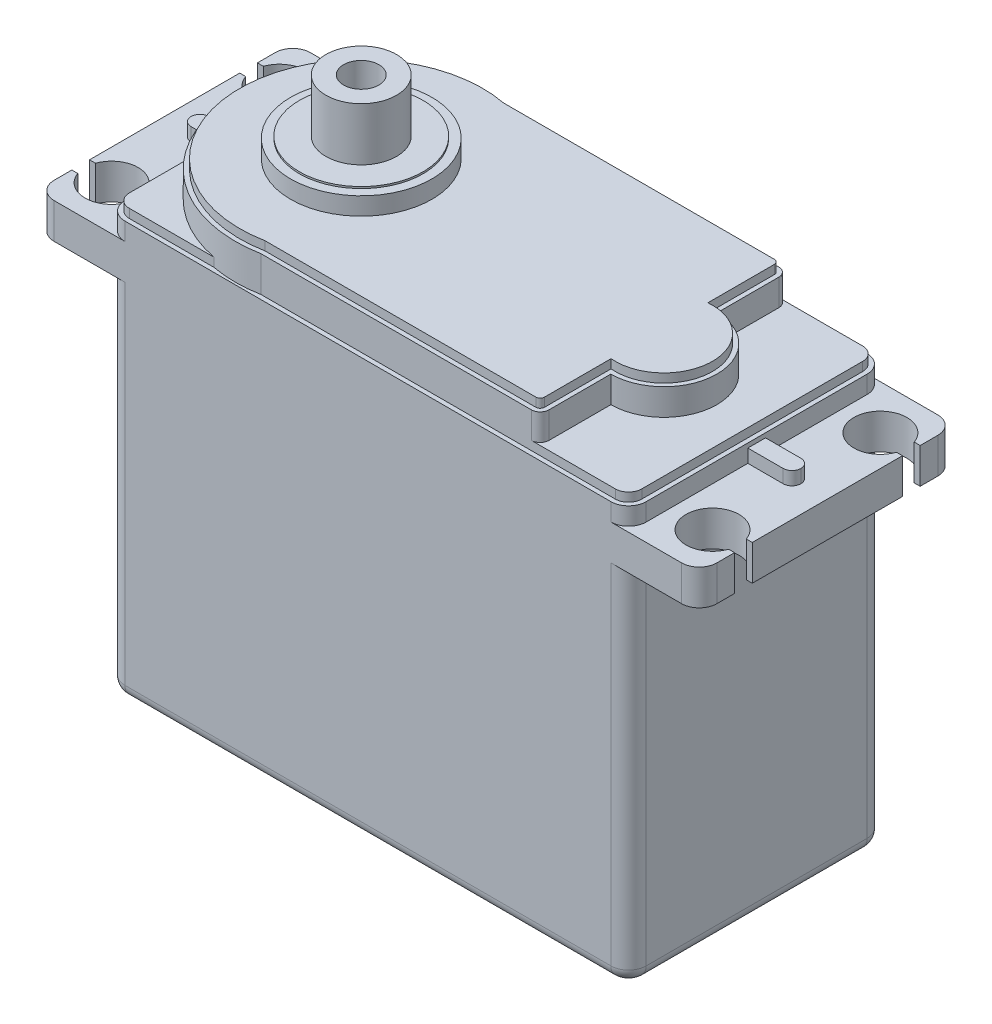
from build123d import *

# Parameters (mm, degrees)
SKETCH2_W            = 59
SKETCH2_H            = 29
BOSS_EXTRUDE1_DEPTH  = 47
FILLET1_R            = 1.5
SKETCH3_W            = 29
SKETCH3_H            = 4
BOSS_EXTRUDE2_DEPTH  = 8
CUT_EXTRUDE1_DEPTH   = 47
FILLET2_R            = 2
SKETCH6_W            = 5
SKETCH6_H            = 2
BOSS_EXTRUDE3_DEPTH  = 1.5
FILLET3_R            = 1
FILLET3_OF_MIRROR2_R = 1
FILLET4_R            = 2
BOSS_EXTRUDE4_DEPTH  = 1
BOSS_EXTRUDE6_DEPTH  = 3
BOSS_EXTRUDE8_REACH  = 64.614
BOSS_EXTRUDE9_REACH  = 64.614
BOSS_EXTRUDE10_REACH = 64.614
FILLET5_R            = 1
BOSS_EXTRUDE11_DEPTH = 1
SKETCH15_R           = 8
BOSS_EXTRUDE12_DEPTH = 2
SKETCH16_R           = 7
BOSS_EXTRUDE13_DEPTH = 0.2
SKETCH17_R           = 4
BOSS_EXTRUDE14_DEPTH = 6
SKETCH18_R           = 2
CUT_EXTRUDE2_DEPTH   = 4


# Some blends are built 0.0001 mm under size
with BuildPart() as part:
    # Sketch2 → Boss-Extrude1 (new body)
    with BuildSketch(Plane(origin=(0, 0, 0), x_dir=(1, 0, 0), z_dir=(0, 1, 0))):
        Rectangle(SKETCH2_W, SKETCH2_H)
    extrude(amount=BOSS_EXTRUDE1_DEPTH)

    # Fillet1
    fillet1_edges = [part.edges().sort_by_distance(p)[0] for p in [
        (0, 0, 14.5),
        (-29.5, 0, 0),
        (0, 0, -14.5),
        (29.5, 0, 0),
    ]]
    fillet(fillet1_edges, radius=FILLET1_R)

    # Sketch3 → Boss-Extrude2 (add)
    with BuildSketch(Plane(origin=(29.5, 0, 0), x_dir=(0, 0, -1), z_dir=(1, 0, 0))):
        with Locations((0, 43)):
            Rectangle(SKETCH3_W, SKETCH3_H)
    boss_extrude2 = extrude(amount=BOSS_EXTRUDE2_DEPTH)

    # Sketch4 → Cut-Extrude1 (cut)
    with BuildSketch(Plane(origin=(0, 45, 0), x_dir=(1, 0, 0), z_dir=(0, 1, 0))):
        with BuildLine():
            Line((36.828427125, -8.5), (37.5, -8.5))
            Line((37.5, -8.5), (37.5, -10.5))
            Line((37.5, -10.5), (36.828427125, -10.5))
            ThreePointArc((36.828427125, -10.5), (31, -9.5), (36.828427125, -8.5))
        make_face()
        with BuildLine():
            Line((37.5, 8.5), (37.5, 10.5))
            Line((37.5, 10.5), (36.828427125, 10.5))
            ThreePointArc((36.828427125, 10.5), (31, 9.5), (36.828427125, 8.5))
            Line((36.828427125, 8.5), (37.5, 8.5))
        make_face()
    cut_extrude1 = extrude(amount=-CUT_EXTRUDE1_DEPTH, mode=Mode.SUBTRACT)

    # Mirror1: Boss-Extrude2, Cut-Extrude1 across plane
    add(boss_extrude2.mirror(Plane(origin=(0, 0, 0), x_dir=(0, 0, 1), z_dir=(1, 0, 0))))
    add(cut_extrude1.mirror(Plane(origin=(0, 0, 0), x_dir=(0, 0, 1), z_dir=(1, 0, 0))), mode=Mode.SUBTRACT)

    # Fillet2
    fillet2_edges = [part.edges().sort_by_distance(p)[0] for p in [
        (37.5, 43, 14.5),
        (37.5, 43, -14.5),
        (-37.5, 43, 14.5),
        (-37.5, 43, -14.5),
    ]]
    fillet(fillet2_edges, radius=FILLET2_R)

    # Sketch6 → Boss-Extrude3 (add)
    with BuildSketch(Plane(origin=(0, 45, 0), x_dir=(1, 0, 0), z_dir=(0, 1, 0))):
        with Locations((32, 0)):
            Rectangle(SKETCH6_W, SKETCH6_H)
    boss_extrude3 = extrude(amount=BOSS_EXTRUDE3_DEPTH)

    # Fillet3
    fillet3_edges = [part.edges().sort_by_distance(p)[0] for p in [
        (34.5, 45.75, -1),
        (34.5, 45.75, 1),
    ]]
    fillet(fillet3_edges, radius=FILLET3_R - 0.0001)  # a hair under: the kernel refuses the full size

    # Mirror2: Boss-Extrude3 across plane
    add(boss_extrude3.mirror(Plane(origin=(0, 0, 0), x_dir=(0, 0, 1), z_dir=(1, 0, 0))))

    # Fillet3 of Mirror2
    fillet3_of_mirror2_edges = [part.edges().sort_by_distance(p)[0] for p in [
        (-34.5, 45.75, -1),
        (-34.5, 45.75, 1),
    ]]
    fillet(fillet3_of_mirror2_edges, radius=FILLET3_OF_MIRROR2_R - 0.0001)  # a hair under: the kernel refuses the full size

    # Fillet4
    # the kernel refuses this fillet: 2 mm, written as the material it takes off along each edge
    with BuildSketch(Plane(origin=(27.5, 0, 12.5), x_dir=(1, 0, 0), z_dir=(0, 0, -1))) as fillet4_piece_1:
        with BuildLine():
            CenterArc((0.5, -1.5), 1.5, 0, 90)
            Line((2, -1.5), (2, 0))
            Line((2, 0), (0.5, 0))
        make_face()
    revolve(axis=Axis((27.5, 0, 12.5), (0, -1, 0)), revolution_arc=90, mode=Mode.SUBTRACT)
    with BuildSketch(Plane(origin=(-27.5, 0, 12.5), x_dir=(0, 0, 1), z_dir=(1, 0, 0))) as fillet4_piece_2:
        with BuildLine():
            CenterArc((0.5, -1.5), 1.5, 0, 90)
            Line((2, -1.5), (2, 0))
            Line((2, 0), (0.5, 0))
        make_face()
    revolve(axis=Axis((-27.5, 0, 12.5), (0, -1, 0)), revolution_arc=90, mode=Mode.SUBTRACT)
    with BuildSketch(Plane(origin=(27.5, 0, -12.5), x_dir=(0, 0, -1), z_dir=(-1, 0, 0))) as fillet4_piece_3:
        with BuildLine():
            CenterArc((0.5, -1.5), 1.5, 0, 90)
            Line((2, -1.5), (2, 0))
            Line((2, 0), (0.5, 0))
        make_face()
    revolve(axis=Axis((27.5, 0, -12.5), (0, -1, 0)), revolution_arc=90, mode=Mode.SUBTRACT)
    with BuildSketch(Plane(origin=(-27.5, 0, -12.5), x_dir=(-1, 0, 0), z_dir=(0, 0, 1))) as fillet4_piece_4:
        with BuildLine():
            CenterArc((0.5, -1.5), 1.5, 0, 90)
            Line((2, -1.5), (2, 0))
            Line((2, 0), (0.5, 0))
        make_face()
    revolve(axis=Axis((-27.5, 0, -12.5), (0, -1, 0)), revolution_arc=90, mode=Mode.SUBTRACT)
    with BuildSketch(Plane(origin=(29.5, 0, 14.5), x_dir=(-1, 0, 0), z_dir=(0, 1, 0)), Plane(origin=(-29.5, 0, -14.5), x_dir=(1, 0, 0), z_dir=(0, 1, 0))) as fillet4_piece_5:
        with BuildLine():
            CenterArc((FILLET4_R, -FILLET4_R), FILLET4_R, 90, 90)
            Line((0, -FILLET4_R), (0, 0))
            Line((0, 0), (FILLET4_R, 0))
        make_face()
    extrude(amount=41, mode=Mode.SUBTRACT)
    with BuildSketch(Plane(origin=(29.5, 0, 14.5), x_dir=(-1, 0, 0), z_dir=(0, 1, 0))) as fillet4_piece_6_section:
        with BuildLine():
            CenterArc((FILLET4_R, -FILLET4_R), FILLET4_R, 90, 90)
            Line((0, -FILLET4_R), (0, 0))
            Line((0, 0), (FILLET4_R, 0))
        make_face()
    fillet4_piece_6 = extrude(amount=46, mode=Mode.PRIVATE)
    fillet4_piece_6 = split(fillet4_piece_6, bisect_by=Plane(origin=(29.047209771, 45, 14.047209771), z_dir=(0, 1, 0)), keep=Keep.TOP, mode=Mode.PRIVATE)
    add(fillet4_piece_6, mode=Mode.SUBTRACT)
    with BuildSketch(Plane(origin=(29.5, 0, -14.5), x_dir=(-1, 0, 0), z_dir=(0, 1, 0)), Plane(origin=(-29.5, 0, 14.5), x_dir=(1, 0, 0), z_dir=(0, 1, 0))) as fillet4_piece_7:
        with BuildLine():
            CenterArc((FILLET4_R, FILLET4_R), FILLET4_R, 180, 90)
            Line((0, FILLET4_R), (0, 0))
            Line((0, 0), (FILLET4_R, 0))
        make_face()
    extrude(amount=41, mode=Mode.SUBTRACT)
    with BuildSketch(Plane(origin=(29.5, 0, -14.5), x_dir=(-1, 0, 0), z_dir=(0, 1, 0))) as fillet4_piece_8_section:
        with BuildLine():
            CenterArc((FILLET4_R, FILLET4_R), FILLET4_R, 180, 90)
            Line((0, FILLET4_R), (0, 0))
            Line((0, 0), (FILLET4_R, 0))
        make_face()
    fillet4_piece_8 = extrude(amount=46, mode=Mode.PRIVATE)
    fillet4_piece_8 = split(fillet4_piece_8, bisect_by=Plane(origin=(29.047209771, 45, -14.047209771), z_dir=(0, 1, 0)), keep=Keep.TOP, mode=Mode.PRIVATE)
    add(fillet4_piece_8, mode=Mode.SUBTRACT)
    with BuildSketch(Plane(origin=(29.5, 40, 14.5), x_dir=(-1, 0, 0), z_dir=(0, 1, 0))) as fillet4_piece_9_section:
        with BuildLine():
            CenterArc((FILLET4_R, -FILLET4_R), FILLET4_R, 90, 90)
            Line((0, -FILLET4_R), (0, 0))
            Line((0, 0), (FILLET4_R, 0))
        make_face()
    fillet4_piece_9 = extrude(amount=12, mode=Mode.PRIVATE)
    fillet4_piece_9 = split(fillet4_piece_9, bisect_by=Plane(origin=(29.047209771, 41, 14.047209771), z_dir=(0, -1, 0)), keep=Keep.TOP, mode=Mode.PRIVATE)
    add(fillet4_piece_9, mode=Mode.SUBTRACT)
    with BuildSketch(Plane(origin=(29.5, 45, 14.5), x_dir=(-1, 0, 0), z_dir=(0, 1, 0)), Plane(origin=(-29.5, 45, 14.5), x_dir=(0, 0, -1), z_dir=(0, 1, 0))) as fillet4_piece_10:
        with BuildLine():
            CenterArc((FILLET4_R, -FILLET4_R), FILLET4_R, 90, 90)
            Line((0, -FILLET4_R), (0, 0))
            Line((0, 0), (FILLET4_R, 0))
        make_face()
    extrude(amount=7, mode=Mode.SUBTRACT)
    with BuildSketch(Plane(origin=(-29.5, 40, 14.5), x_dir=(0, 0, -1), z_dir=(0, 1, 0))) as fillet4_piece_11_section:
        with BuildLine():
            CenterArc((FILLET4_R, -FILLET4_R), FILLET4_R, 90, 90)
            Line((0, -FILLET4_R), (0, 0))
            Line((0, 0), (FILLET4_R, 0))
        make_face()
    fillet4_piece_11 = extrude(amount=12, mode=Mode.PRIVATE)
    fillet4_piece_11 = split(fillet4_piece_11, bisect_by=Plane(origin=(-29.047209771, 41, 14.047209771), z_dir=(0, -1, 0)), keep=Keep.TOP, mode=Mode.PRIVATE)
    add(fillet4_piece_11, mode=Mode.SUBTRACT)
    with BuildSketch(Plane(origin=(-29.5, 40, -14.5), x_dir=(0, 0, 1), z_dir=(0, 1, 0))) as fillet4_piece_12_section:
        with BuildLine():
            CenterArc((FILLET4_R, FILLET4_R), FILLET4_R, 180, 90)
            Line((0, FILLET4_R), (0, 0))
            Line((0, 0), (FILLET4_R, 0))
        make_face()
    fillet4_piece_12 = extrude(amount=12, mode=Mode.PRIVATE)
    fillet4_piece_12 = split(fillet4_piece_12, bisect_by=Plane(origin=(-29.047209771, 41, -14.047209771), z_dir=(0, -1, 0)), keep=Keep.TOP, mode=Mode.PRIVATE)
    add(fillet4_piece_12, mode=Mode.SUBTRACT)
    with BuildSketch(Plane(origin=(-29.5, 45, -14.5), x_dir=(0, 0, 1), z_dir=(0, 1, 0)), Plane(origin=(29.5, 45, -14.5), x_dir=(-1, 0, 0), z_dir=(0, 1, 0))) as fillet4_piece_13:
        with BuildLine():
            CenterArc((FILLET4_R, FILLET4_R), FILLET4_R, 180, 90)
            Line((0, FILLET4_R), (0, 0))
            Line((0, 0), (FILLET4_R, 0))
        make_face()
    extrude(amount=7, mode=Mode.SUBTRACT)
    with BuildSketch(Plane(origin=(29.5, 40, -14.5), x_dir=(-1, 0, 0), z_dir=(0, 1, 0))) as fillet4_piece_14_section:
        with BuildLine():
            CenterArc((FILLET4_R, FILLET4_R), FILLET4_R, 180, 90)
            Line((0, FILLET4_R), (0, 0))
            Line((0, 0), (FILLET4_R, 0))
        make_face()
    fillet4_piece_14 = extrude(amount=12, mode=Mode.PRIVATE)
    fillet4_piece_14 = split(fillet4_piece_14, bisect_by=Plane(origin=(29.047209771, 41, -14.047209771), z_dir=(0, -1, 0)), keep=Keep.TOP, mode=Mode.PRIVATE)
    add(fillet4_piece_14, mode=Mode.SUBTRACT)
    with BuildSketch(Plane(origin=(-29.5, 0, 14.5), x_dir=(1, 0, 0), z_dir=(0, 1, 0))) as fillet4_piece_15_section:
        with BuildLine():
            CenterArc((FILLET4_R, FILLET4_R), FILLET4_R, 180, 90)
            Line((0, FILLET4_R), (0, 0))
            Line((0, 0), (FILLET4_R, 0))
        make_face()
    fillet4_piece_15 = extrude(amount=46, mode=Mode.PRIVATE)
    fillet4_piece_15 = split(fillet4_piece_15, bisect_by=Plane(origin=(-29.047209771, 45, 14.047209771), z_dir=(0, 1, 0)), keep=Keep.TOP, mode=Mode.PRIVATE)
    add(fillet4_piece_15, mode=Mode.SUBTRACT)
    with BuildSketch(Plane(origin=(-29.5, 0, -14.5), x_dir=(1, 0, 0), z_dir=(0, 1, 0))) as fillet4_piece_16_section:
        with BuildLine():
            CenterArc((FILLET4_R, -FILLET4_R), FILLET4_R, 90, 90)
            Line((0, -FILLET4_R), (0, 0))
            Line((0, 0), (FILLET4_R, 0))
        make_face()
    fillet4_piece_16 = extrude(amount=46, mode=Mode.PRIVATE)
    fillet4_piece_16 = split(fillet4_piece_16, bisect_by=Plane(origin=(-29.047209771, 45, -14.047209771), z_dir=(0, 1, 0)), keep=Keep.TOP, mode=Mode.PRIVATE)
    add(fillet4_piece_16, mode=Mode.SUBTRACT)

    # Sketch7 → Boss-Extrude4 (add)
    with BuildSketch(Plane(origin=(0, 47, 0), x_dir=(1, 0, 0), z_dir=(0, 1, 0))):
        with BuildLine():
            Line((-29, 12.5), (-29, -12.5))
            ThreePointArc((-29, -12.5), (-28.560660172, -13.560660172), (-27.5, -14))
            Line((-27.5, -14), (27.5, -14))
            ThreePointArc((27.5, -14), (28.560660172, -13.560660172), (29, -12.5))
            Line((29, -12.5), (29, 12.5))
            ThreePointArc((29, 12.5), (28.560660172, 13.560660172), (27.5, 14))
            Line((27.5, 14), (-27.5, 14))
            ThreePointArc((-27.5, 14), (-28.560660172, 13.560660172), (-29, 12.5))
        make_face()
    extrude(amount=BOSS_EXTRUDE4_DEPTH)

    # Sketch8 → Boss-Extrude6 (add)
    with BuildSketch(Plane(origin=(0, 48, 0), x_dir=(1, 0, 0), z_dir=(0, 1, 0))):
        with BuildLine():
            Line((19, -14), (-12.592463547, -14))
            ThreePointArc((-12.592463547, -14), (-29.5, 0), (-12.592463547, 14))
            Line((-12.592463547, 14), (19, 14))
            Line((19, 14), (19, 6))
            ThreePointArc((19, 6), (25, 0), (19, -6))
            Line((19, -6), (19, -14))
        make_face()
    extrude(amount=BOSS_EXTRUDE6_DEPTH)

    # Sketch10 → Boss-Extrude8 (add, up to next)
    with BuildSketch(Plane.XZ.offset(-48), mode=Mode.PRIVATE) as boss_extrude8_sk1:
        with BuildLine():
            Line((-17.907536453, 14), (-12.592463547, 14))
            ThreePointArc((-12.592463547, 14), (-15.25, 14.25), (-17.907536453, 14))
        make_face()
    boss_extrude8_tool1 = extrude(boss_extrude8_sk1.sketch, amount=BOSS_EXTRUDE8_REACH, mode=Mode.PRIVATE) - part.part
    add(boss_extrude8_tool1.solids().sort_by_distance((-15.25, 48, 14.100076))[0])

    # Sketch11 → Boss-Extrude9 (add, up to next)
    with BuildSketch(Plane.XZ.offset(-48), mode=Mode.PRIVATE) as boss_extrude9_sk1:
        with BuildLine():
            Line((-29, -3.741657387), (-29, 3.741657387))
            ThreePointArc((-29, 3.741657387), (-29.5, 0), (-29, -3.741657387))
        make_face()
    boss_extrude9_tool1 = extrude(boss_extrude9_sk1.sketch, amount=BOSS_EXTRUDE9_REACH, mode=Mode.PRIVATE) - part.part
    add(boss_extrude9_tool1.solids().sort_by_distance((-29.200304, 48, 0))[0])

    # Sketch12 → Boss-Extrude10 (add, up to next)
    with BuildSketch(Plane.XZ.offset(-48), mode=Mode.PRIVATE) as boss_extrude10_sk1:
        with BuildLine():
            Line((-12.592463547, -14), (-17.907536453, -14))
            ThreePointArc((-17.907536453, -14), (-15.25, -14.25), (-12.592463547, -14))
        make_face()
    boss_extrude10_tool1 = extrude(boss_extrude10_sk1.sketch, amount=BOSS_EXTRUDE10_REACH, mode=Mode.PRIVATE) - part.part
    add(boss_extrude10_tool1.solids().sort_by_distance((-15.25, 48, -14.100076))[0])

    # Fillet5
    fillet5_edges = [part.edges().sort_by_distance(p)[0] for p in [
        (19, 49.5, 14),
        (19, 49.5, -14),
    ]]
    fillet(fillet5_edges, radius=FILLET5_R)

    # Sketch13 → Boss-Extrude11 (add)
    with BuildSketch(Plane(origin=(0, 51, 0), x_dir=(1, 0, 0), z_dir=(0, 1, 0))):
        with BuildLine():
            Line((18.5, 5.477225575), (18.5, 13))
            ThreePointArc((18.5, 13), (18.353553391, 13.353553391), (18, 13.5))
            Line((18, 13.5), (-12.639923373, 13.5))
            ThreePointArc((-12.639923373, 13.5), (-29, 0), (-12.639923373, -13.5))
            Line((-12.639923373, -13.5), (18, -13.5))
            ThreePointArc((18, -13.5), (18.353553391, -13.353553391), (18.5, -13))
            Line((18.5, -13), (18.5, -5.477225575))
            ThreePointArc((18.5, -5.477225575), (24.5, 0), (18.5, 5.477225575))
        make_face()
    extrude(amount=BOSS_EXTRUDE11_DEPTH)

    # Sketch15 → Boss-Extrude12 (add)
    with BuildSketch(Plane(origin=(0, 52, 0), x_dir=(1, 0, 0), z_dir=(0, 1, 0))):
        with Locations(Location((-15.25, 0, 0), (0, 0, 270))):
            Circle(SKETCH15_R)
    extrude(amount=BOSS_EXTRUDE12_DEPTH)

    # Sketch16 → Boss-Extrude13 (add)
    with BuildSketch(Plane(origin=(0, 54, 0), x_dir=(1, 0, 0), z_dir=(0, 1, 0))):
        with Locations(Location((-15.25, 0, 0), (0, 0, 270))):
            Circle(SKETCH16_R)
    extrude(amount=BOSS_EXTRUDE13_DEPTH)

    # Sketch17 → Boss-Extrude14 (add)
    with BuildSketch(Plane(origin=(0, 54.2, 0), x_dir=(1, 0, 0), z_dir=(0, 1, 0))):
        with Locations(Location((-15.25, 0, 0), (0, 0, 270))):
            Circle(SKETCH17_R)
    extrude(amount=BOSS_EXTRUDE14_DEPTH)

    # Sketch18 → Cut-Extrude2 (cut)
    with BuildSketch(Plane(origin=(0, 60.2, 0), x_dir=(1, 0, 0), z_dir=(0, 1, 0))):
        with Locations(Location((-15.25, 0, 0), (0, 0, 270))):
            Circle(SKETCH18_R)
    extrude(amount=-CUT_EXTRUDE2_DEPTH, mode=Mode.SUBTRACT)


solid = part.part
